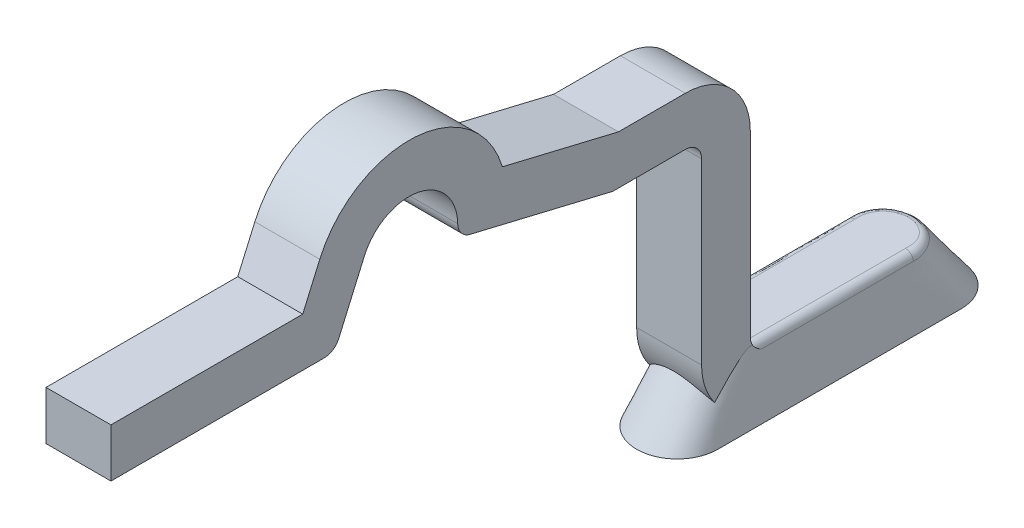
from build123d import *

# Parameters (mm, degrees)
EXTRUDE_THIN1_DEPTH = 0.2
FILLET2_R           = 0.05


with BuildPart() as part:
    # Sketch1 → Extrude-Thin1 (new, symmetric)
    with BuildSketch(Plane(origin=(0, 0, 0), x_dir=(0, 0, -1), z_dir=(1, 0, 0))):
        with BuildLine():
            Line((1, 0), (0.4, 0))
            ThreePointArc((0.4, 0), (0.117157288, 0.117157288), (0, 0.4))
            Line((0, 0.4), (0, 1.5))
            ThreePointArc((0, 1.5), (-0.029289322, 1.570710678), (-0.1, 1.6))
            Line((-0.1, 1.6), (-0.547288345, 1.6))
            Line((-0.547288345, 1.6), (-1.425818848, 1.809970546))
            ThreePointArc((-1.425818848, 1.809970546), (-1.480510309, 1.844574821), (-1.502557001, 1.905423445))
            ThreePointArc((-1.502557001, 1.905423445), (-1.743775296, 2.194194617), (-2.077383393, 2.02018113))
            Line((-2.077383393, 2.02018113), (-2.234888314, 1.659939623))
            ThreePointArc((-2.234888314, 1.659939623), (-2.271768763, 1.616315958), (-2.326513454, 1.6))
            Line((-2.326513454, 1.6), (-3.638902143, 1.6))
            Line((-3.638902143, 1.6), (-3.638902143, 1.9))
            Line((-3.638902143, 1.9), (-2.457350086, 1.9))
            Line((-2.457350086, 1.9), (-2.352258812, 2.14036226))
            ThreePointArc((-2.352258812, 2.14036226), (-1.765577917, 2.498862397), (-1.227389964, 2.070994955))
            Line((-1.227389964, 2.070994955), (-0.511935885, 1.9))
            Line((-0.511935885, 1.9), (-0.1, 1.9))
            ThreePointArc((-0.1, 1.9), (0.182842712, 1.782842712), (0.3, 1.5))
            Line((0.3, 1.5), (0.3, 0.4))
            ThreePointArc((0.3, 0.4), (0.329289322, 0.329289322), (0.4, 0.3))
            Line((0.4, 0.3), (1, 0.3))
            Line((1, 0.3), (1, 0))
        make_face()
    extrude(amount=EXTRUDE_THIN1_DEPTH, both=True)

    # Sketch3 → Loft1 section 0
    with BuildSketch(Plane(origin=(0, 0.35, 0), x_dir=(1, 0, 0), z_dir=(0, 1, 0))):
        with BuildLine():
            Line((0.2, 1.3), (0.2, 0.3))
            ThreePointArc((0.2, 0.3), (0, 0.1), (-0.2, 0.3))
            Line((-0.2, 0.3), (-0.2, 1.3))
            ThreePointArc((-0.2, 1.3), (0, 1.5), (0.2, 1.3))
        make_face()
    # Sketch2 → Loft1 section 1
    with BuildSketch(Plane(origin=(0, -0.05, 0), x_dir=(1, 0, 0), z_dir=(0, 1, 0))):
        with BuildLine():
            Line((0.25, 1.55), (0.25, 0.05))
            ThreePointArc((0.25, 0.05), (0, -0.2), (-0.25, 0.05))
            Line((-0.25, 0.05), (-0.25, 1.55))
            ThreePointArc((-0.25, 1.55), (0, 1.8), (0.25, 1.55))
        make_face()
    loft()

    # Fillet2
    fillet2_edges = [part.edges().sort_by_distance(p)[0] for p in [
        (0.2, 0.35, -0.80669873),
        (-0.2, 0.35, -0.80669873),
    ]]
    fillet(fillet2_edges, radius=FILLET2_R)


solid = part.part
